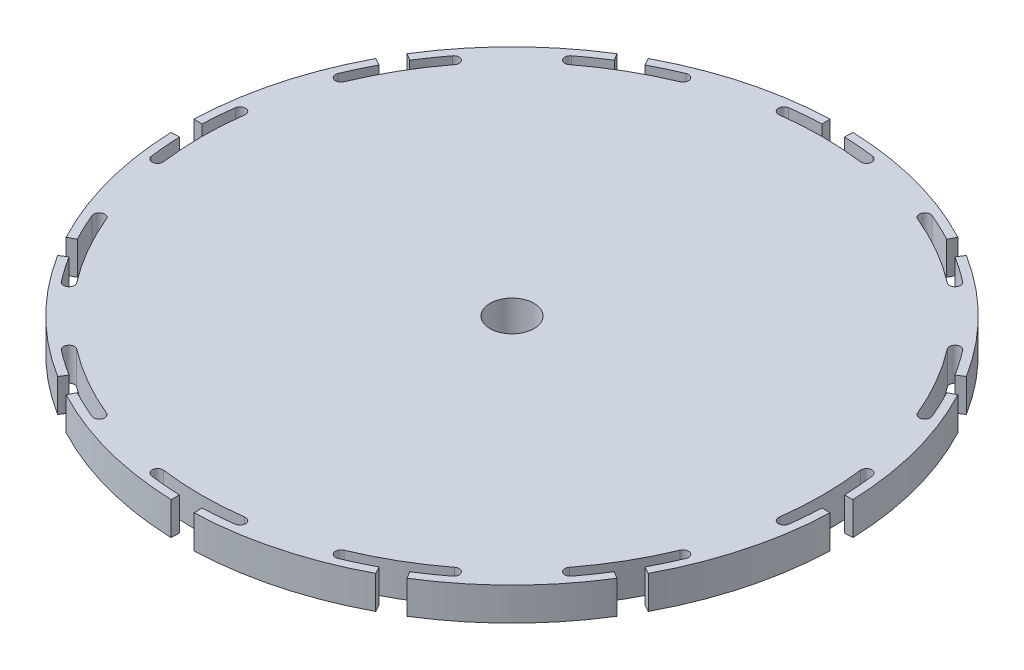
from build123d import *

# Parameters (mm, degrees)
SKETCH1_R         = 60
WHEEL_BLANK_DEPTH = 6
T_SLOT_DEPTH      = 86.064681273
CIRPATTERN_COUNT  = 12
SKETCH3_R         = 4
CENTER_HOLE_DEPTH = 6


with BuildPart() as part:
    # Sketch1 → Wheel Blank (new body)
    with BuildSketch(Plane(origin=(0, 0, 0), x_dir=(1, 0, 0), z_dir=(0, 1, 0))):
        Circle(SKETCH1_R)
    extrude(amount=WHEEL_BLANK_DEPTH)

    # Sketch2 → T-Slot (cut, through all)
    with BuildSketch(Plane(origin=(0, 0, 0), x_dir=(1, 0, 0), z_dir=(0, 1, 0))):
        with BuildLine():
            Line((-2.093969802, 59.963449621), (-2.041620557, 58.464363381))
            ThreePointArc((-2.041620557, 58.464363381), (-4.844280139, 58.299081896), (-7.635782245, 57.99952439))
            ThreePointArc((-7.635782245, 57.99952439), (-8.496700914, 56.877553337), (-7.37472986, 56.016634668))
            ThreePointArc((-7.37472986, 56.016634668), (0, 56.5), (7.37472986, 56.016634668))
            ThreePointArc((7.37472986, 56.016634668), (8.496700914, 56.877553337), (7.635782245, 57.99952439))
            ThreePointArc((7.635782245, 57.99952439), (4.844280139, 58.299081896), (2.041620557, 58.464363381))
            Line((2.041620557, 58.464363381), (2.093969802, 59.963449621))
            ThreePointArc((2.093969802, 59.963449621), (0, 60), (-2.093969802, 59.963449621))
        make_face()
    t_slot = extrude(amount=T_SLOT_DEPTH, mode=Mode.SUBTRACT)

    # CirPattern: T-Slot ×12 about axis
    cirpattern_axis = Axis((0, 6, 0), (0, -1, 0))
    for i in range(1, CIRPATTERN_COUNT):
        add(t_slot.rotate(cirpattern_axis, i * 360 / CIRPATTERN_COUNT), mode=Mode.SUBTRACT)

    # Sketch3 → Center Hole (cut)
    with BuildSketch(Plane(origin=(0, 0, 0), x_dir=(1, 0, 0), z_dir=(0, 1, 0))):
        Circle(SKETCH3_R)
    extrude(amount=CENTER_HOLE_DEPTH, mode=Mode.SUBTRACT)


solid = part.part
